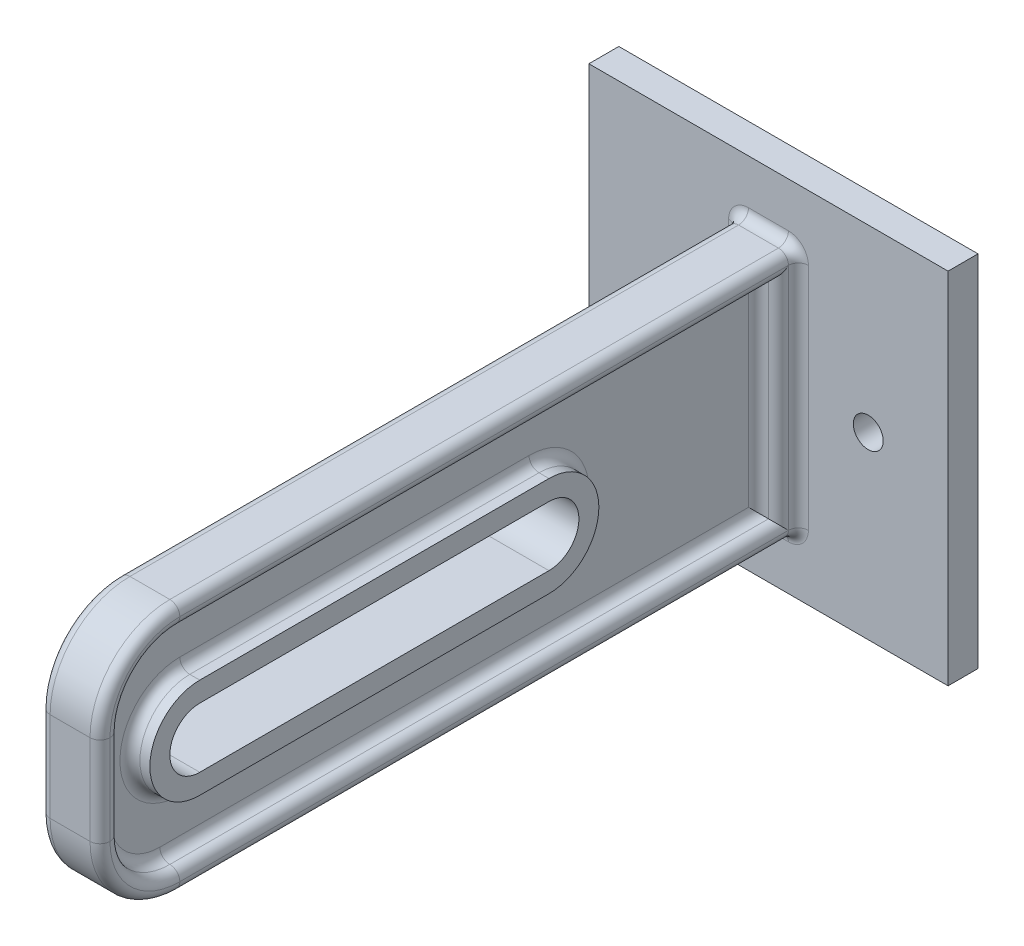
from build123d import *

# Parameters (mm, degrees)
SKETCH1_W           = 36
SKETCH1_H           = 36
BOSS_EXTRUDE1_DEPTH = 3
SKETCH2_R           = 1.5
CUT_EXTRUDE1_DEPTH  = 26.632011236
SKETCH3_W           = 6
SKETCH3_H           = 25
BOSS_EXTRUDE2_DEPTH = 70
CUT_EXTRUDE2_DEPTH  = 79.064076245
FILLET1_R           = 8
CUT_EXTRUDE3_DEPTH  = 2
FILLET2_R           = 1
FILLET3_R           = 1
FILLET4_R           = 1
FILLET6_R           = 1
FILLET5_R           = 1
FILLET9_R           = 1


with BuildPart() as part:
    # Sketch1 → Boss-Extrude1 (new body)
    with BuildSketch(Plane.XY):
        Rectangle(SKETCH1_W, SKETCH1_H)
    extrude(amount=BOSS_EXTRUDE1_DEPTH)

    # Sketch2 → Cut-Extrude1 (cut, through all)
    with BuildSketch(Plane.XY.offset(3)):
        with Locations((-10, 0)):
            Circle(SKETCH2_R)
        with Locations((10, 0)):
            Circle(SKETCH2_R)
    extrude(amount=-CUT_EXTRUDE1_DEPTH, mode=Mode.SUBTRACT)

    # Sketch3 → Boss-Extrude2 (add)
    with BuildSketch(Plane.XY.offset(3)):
        Rectangle(SKETCH3_W, SKETCH3_H)
    extrude(amount=BOSS_EXTRUDE2_DEPTH)

    # Sketch5 → Cut-Extrude2 (cut, through all)
    with BuildSketch(Plane(origin=(3, 0, 0), x_dir=(0, 0, -1), z_dir=(1, 0, 0))):
        with BuildLine():
            Line((-63, 3), (-28, 3))
            ThreePointArc((-28, 3), (-25, 0), (-28, -3))
            Line((-28, -3), (-63, -3))
            ThreePointArc((-63, -3), (-66, 0), (-63, 3))
        make_face()
    extrude(amount=-CUT_EXTRUDE2_DEPTH, mode=Mode.SUBTRACT)

    # Fillet1
    fillet1_edges = [part.edges().sort_by_distance(p)[0] for p in [
        (0, 12.5, 73),
        (0, -12.5, 73),
    ]]
    fillet(fillet1_edges, radius=FILLET1_R)

    # Sketch6 → Cut-Extrude3 (cut)
    with BuildSketch(Plane(origin=(3, 0, 0), x_dir=(0, 0, -1), z_dir=(1, 0, 0))):
        with BuildLine():
            Line((-5, 10.5), (-65, 10.5))
            ThreePointArc((-65, 10.5), (-69.242640687, 8.742640687), (-71, 4.5))
            Line((-71, 4.5), (-71, -4.5))
            ThreePointArc((-71, -4.5), (-69.242640687, -8.742640687), (-65, -10.5))
            Line((-65, -10.5), (-5, -10.5))
            Line((-5, -10.5), (-5, 10.5))
        make_face()
        with BuildLine():
            Line((-28, 5), (-63, 5))
            ThreePointArc((-63, 5), (-68, 0), (-63, -5))
            Line((-63, -5), (-28, -5))
            ThreePointArc((-28, -5), (-23, 0), (-28, 5))
        make_face(mode=Mode.SUBTRACT)
    cut_extrude3 = extrude(amount=-CUT_EXTRUDE3_DEPTH, mode=Mode.SUBTRACT)

    # Mirror1: Cut-Extrude3 across plane
    add(cut_extrude3.mirror(Plane(origin=(0, 0, 0), x_dir=(0, 0, 1), z_dir=(1, 0, 0))), mode=Mode.SUBTRACT)

    # Fillet2
    fillet2_edges = [part.edges().sort_by_distance(p)[0] for p in [
        (-1, 0, 5),
        (-1, 10.5, 35),
        (-1, 8.742640687, 69.242640687),
        (-1, 0, 71),
        (-1, -8.742640687, 69.242640687),
        (-1, -10.5, 35),
        (1, 0, 5),
        (1, -10.5, 35),
        (1, -8.742640687, 69.242640687),
        (1, 0, 71),
        (1, 8.742640687, 69.242640687),
        (1, 10.5, 35),
    ]]
    fillet(fillet2_edges, radius=FILLET2_R)

    # Fillet3
    fillet3_edges = [part.edges().sort_by_distance(p)[0] for p in [
        (-1, 0, 23),
        (-1, 5, 45.5),
        (-1, 0, 68),
        (-1, -5, 45.5),
        (1, -5, 45.5),
        (1, 0, 23),
        (1, 5, 45.5),
        (1, 0, 68),
    ]]
    fillet(fillet3_edges, radius=FILLET3_R)

    # Fillet4
    fillet4_edges = [part.edges().sort_by_distance(p)[0] for p in [
        (3, 0, 73),
        (-3, 0, 73),
        (-3, -12.5, 34),
        (-3, 12.5, 34),
        (-3, -10.156854249, 70.656854249),
        (-3, 10.156854249, 70.656854249),
        (3, 12.5, 34),
        (3, -12.5, 34),
        (3, -10.156854249, 70.656854249),
        (3, 10.156854249, 70.656854249),
    ]]
    fillet(fillet4_edges, radius=FILLET4_R)

    # Fillet6
    fillet6_edges = [part.edges().sort_by_distance(p)[0] for p in [
        (-3, -10.5, 35),
        (-3, -8.742640687, 69.242640687),
        (-3, 0, 71),
        (-3, 8.742640687, 69.242640687),
        (-3, 10.5, 35),
        (-3, 0, 5),
        (3, 10.5, 35),
        (3, 8.742640687, 69.242640687),
        (3, -10.5, 35),
        (3, -8.742640687, 69.242640687),
        (3, 0, 71),
    ]]
    fillet(fillet6_edges, radius=FILLET6_R - 0.0001)  # a hair under: the kernel refuses the full size

    # Fillet5
    fillet5_edges = [part.edges().sort_by_distance(p)[0] for p in [
        (0, 12.5, 3),
        (-2.707106781, 12.207106781, 3),
        (0, -12.5, 3),
        (-2.707106781, -12.207106781, 3),
        (-3, 0, 3),
        (2.707106781, 12.207106781, 3),
        (3, 0, 3),
        (2.707106781, -12.207106781, 3),
    ]]
    fillet(fillet5_edges, radius=FILLET5_R)

    # Fillet9
    fillet9_edges = [part.edges().sort_by_distance(p)[0] for p in [
        (3, 0, 5),
    ]]
    fillet(fillet9_edges, radius=FILLET9_R - 0.0001)  # a hair under: the kernel refuses the full size


solid = part.part
